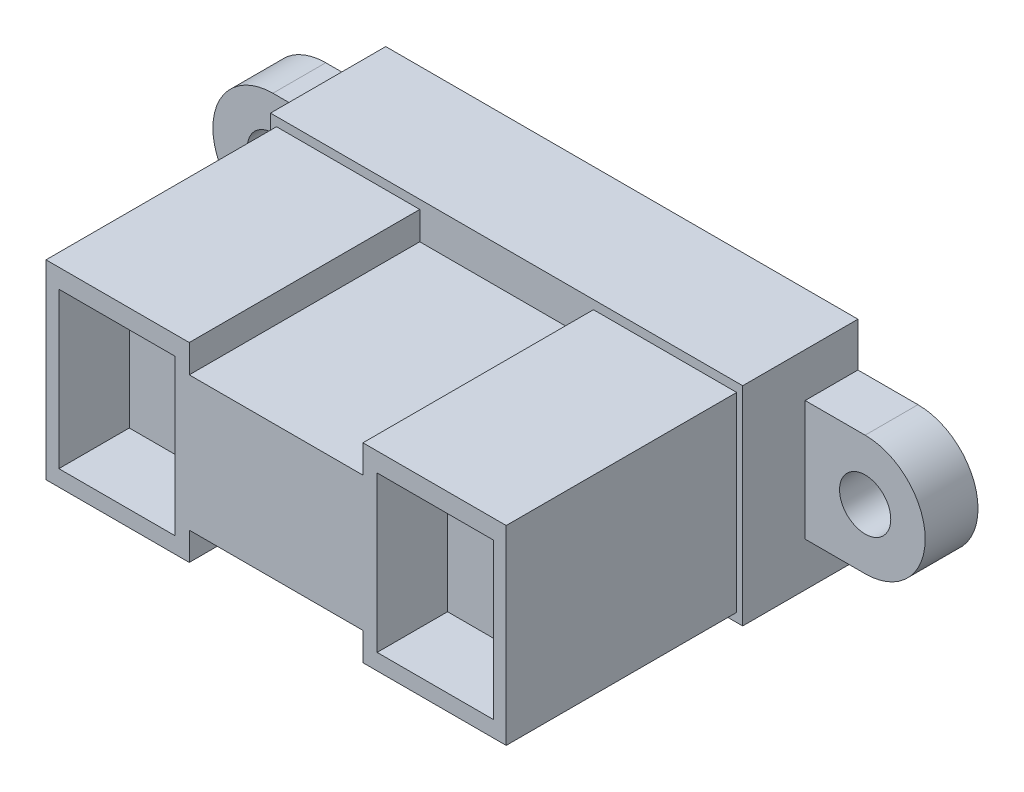
from build123d import *

# Parameters (mm, degrees)
EXTRUDE_1_DEPTH       = 3.3
SKETCH_1_3_W          = 29.5
SKETCH_1_3_H          = 13
EXTRUDE_2_DEPTH       = 21.6
SKETCH_3_W            = 29.5
SKETCH_3_H            = 13
CUT_EXTRUDE_1_DEPTH   = 14.4
SKETCH_4_W            = 7.25988549
SKETCH_4_H            = 9.71067486
CUT_EXTRUDE_2_DEPTH   = 4.4
SKETCH_5_W            = 10.1
SKETCH_5_H            = 1.2
EXTRUDE_3_DEPTH       = 8.2
EXTRUDE_4_OUTLINE_W   = 6.05761146
EXTRUDE_4_OUTLINE_H   = 3.941693248
EXTRUDE_4_OUTLINE_W_2 = 5.05761146
EXTRUDE_4_OUTLINE_H_2 = 2.2
EXTRUDE_4_DEPTH       = 7.5
SKETCH_6_R            = 1.6
CUT_EXTRUDE_3_DEPTH   = 7.5


# Read off the part's stored shape, not the designer's step: 凸台-拉伸4
with BuildPart() as part:
    # 草图1 → 凸台-拉伸1 (new body)
    with BuildSketch(Plane.XY):
        with BuildLine():
            ThreePointArc((-18.5, 3.75), (-22.25, 0), (-18.5, -3.75))
            Line((-18.5, -3.75), (-18.5, 3.75))
        make_face()
        with BuildLine():
            Line((-18.5, 3.75), (-18.5, -3.75))
            ThreePointArc((-18.5, -3.75), (-15.848349571, -2.651650429), (-14.75, 0))
            ThreePointArc((-14.75, 0), (-15.848349571, 2.651650429), (-18.5, 3.75))
        make_face()
        with BuildLine():
            Line((-14.75, 3.75), (-18.5, 3.75))
            ThreePointArc((-18.5, 3.75), (-15.848349571, 2.651650429), (-14.75, 0))
            Line((-14.75, 0), (-14.75, 3.75))
        make_face()
        with BuildLine():
            ThreePointArc((-14.75, 0), (-15.848349571, -2.651650429), (-18.5, -3.75))
            Line((-18.5, -3.75), (-14.75, -3.75))
            Line((-14.75, -3.75), (-14.75, 0))
        make_face()
        Polygon((-14.75, 0), (-14.75, -3.75), (14.75, -3.75), (14.75, -4e-09), (14.75, 3.75), (-14.75, 3.75), align=None)
        with BuildLine():
            ThreePointArc((14.75, -4e-09), (15.848349572, -2.651650431), (18.5, -3.75))
            Line((18.5, -3.75), (18.5, 3.75))
            ThreePointArc((18.5, 3.75), (15.848349569, 2.651650428), (14.75, -4e-09))
        make_face()
        with BuildLine():
            Line((18.5, 3.75), (18.5, -3.75))
            ThreePointArc((18.5, -3.75), (21.151650429, -2.651650429), (22.25, 0))
            ThreePointArc((22.25, 0), (21.151650429, 2.651650429), (18.5, 3.75))
        make_face()
        with BuildLine():
            Line((14.75, 3.75), (14.75, -4e-09))
            ThreePointArc((14.75, -4e-09), (15.848349569, 2.651650428), (18.5, 3.75))
            Line((18.5, 3.75), (14.75, 3.75))
        make_face()
        with BuildLine():
            Line((14.75, -4e-09), (14.75, -3.75))
            Line((14.75, -3.75), (18.5, -3.75))
            ThreePointArc((18.5, -3.75), (15.848349572, -2.651650431), (14.75, -4e-09))
        make_face()
    extrude(amount=EXTRUDE_1_DEPTH)

    # 草图1<3> → 凸台-拉伸2 (add)
    with BuildSketch(Plane.XY):
        Rectangle(SKETCH_1_3_W, SKETCH_1_3_H)
    extrude(amount=EXTRUDE_2_DEPTH)

    # 草图3 → 切除-拉伸1 (cut)
    with BuildSketch(Plane.XY.offset(21.6)):
        Rectangle(SKETCH_3_W, SKETCH_3_H)
        Polygon((-14.375, -5.95), (-14.375, 5.95), (-5.425, 5.95), (-5.425, 4.2), (5.425, 4.2), (5.425, 5.95), (14.375, 5.95), (14.375, -5.95), (5.425, -5.95), (5.425, -4.2), (-5.425, -4.2), (-5.425, -5.95), align=None, mode=Mode.SUBTRACT)
    extrude(amount=-CUT_EXTRUDE_1_DEPTH, mode=Mode.SUBTRACT)

    # 草图4 → 切除-拉伸2 (cut)
    with BuildSketch(Plane.XY.offset(21.6)):
        with Locations((-9.941881404, -0.092482618)):
            Rectangle(SKETCH_4_W, SKETCH_4_H)
        with Locations((9.941881404, -0.092482618)):
            Rectangle(SKETCH_4_W, SKETCH_4_H)
    extrude(amount=-CUT_EXTRUDE_2_DEPTH, mode=Mode.SUBTRACT)

    # 草图5 → 凸台-拉伸3 (add)
    with BuildSketch(Plane.XZ.offset(4.2)):
        with Locations((0, 3.9)):
            Rectangle(SKETCH_5_W, SKETCH_5_H)
    extrude(amount=EXTRUDE_3_DEPTH)

    # 凸台-拉伸4 outline → 凸台-拉伸4 (add)
    with BuildSketch(Plane.XZ.offset(4.2)):
        with Locations((0, 6.470846624)):
            Rectangle(EXTRUDE_4_OUTLINE_W, EXTRUDE_4_OUTLINE_H)
        with Locations((0, 6.1)):
            Rectangle(EXTRUDE_4_OUTLINE_W_2, EXTRUDE_4_OUTLINE_H_2, mode=Mode.SUBTRACT)
    extrude(amount=EXTRUDE_4_DEPTH)

    # 草图6 → 切除-拉伸3 (cut)
    with BuildSketch(Plane.XY.offset(3.3)):
        with Locations((-18.5, 0)):
            Circle(SKETCH_6_R)
        with Locations((18.5, 0)):
            Circle(SKETCH_6_R)
    extrude(amount=-CUT_EXTRUDE_3_DEPTH, mode=Mode.SUBTRACT)


solid = part.part
